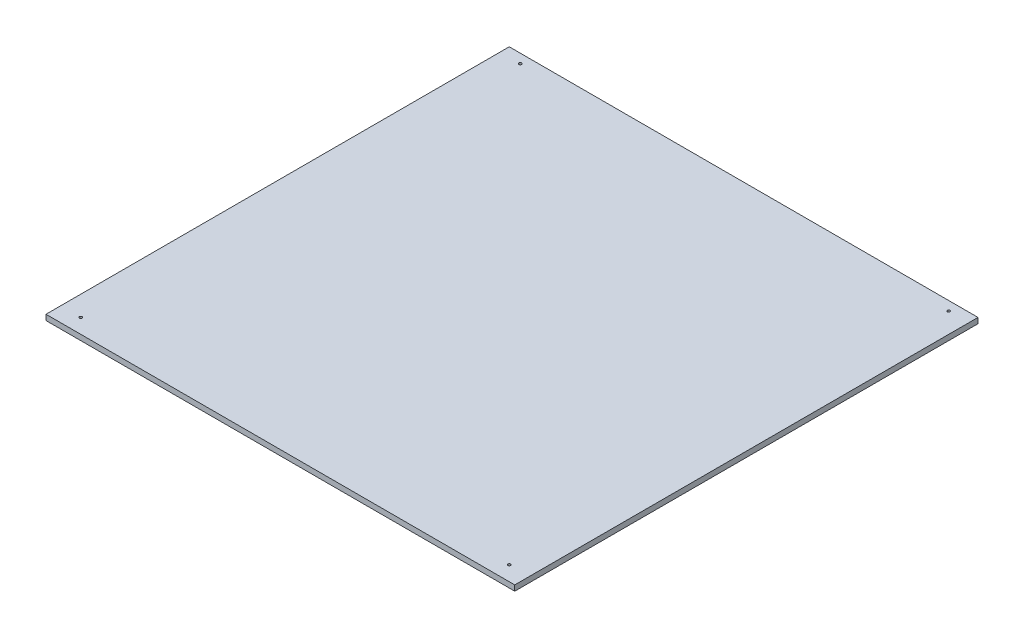
from build123d import *

# Parameters (mm, degrees)
SKETCH1_W           = 500
SKETCH1_H           = 500
SKETCH1_R           = 1.5
SKETCH1_R_2         = 1.525
BOSS_EXTRUDE1_DEPTH = 6
BOSS_EXTRUDE2_DEPTH = 6


with BuildPart() as part:
    # Sketch1 → Boss-Extrude1 (new body)
    with BuildSketch(Plane(origin=(0, 0, 0), x_dir=(1, 0, 0), z_dir=(0, 1, 0))):
        with Locations((250, -250)):
            Rectangle(SKETCH1_W, SKETCH1_H)
        with Locations((16, -10)):
            Circle(SKETCH1_R, mode=Mode.SUBTRACT)
        with Locations((484, -10)):
            Circle(SKETCH1_R, mode=Mode.SUBTRACT)
        with Locations((484, -490)):
            Circle(SKETCH1_R, mode=Mode.SUBTRACT)
        with Locations((16, -490)):
            Circle(SKETCH1_R_2, mode=Mode.SUBTRACT)
    extrude(amount=BOSS_EXTRUDE1_DEPTH)

    # Sketch2 → Boss-Extrude2 (add)
    with BuildSketch(Plane.XZ):
        Polygon((-6, 506), (-6, 0), (0, 0), (0, 500), (500, 500), (500, 0), (506, 0), (506, 506), align=None)
    extrude(amount=-BOSS_EXTRUDE2_DEPTH)


solid = part.part
